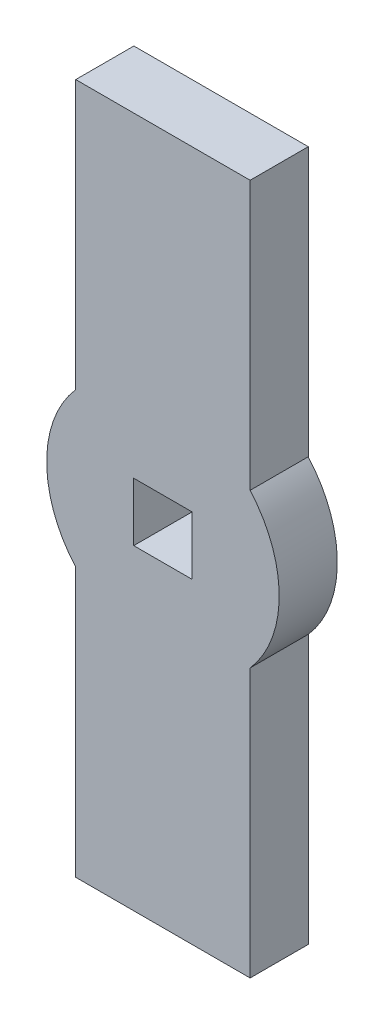
from build123d import *

# Parameters (mm, degrees)
SKETCH2_R           = 2.032
BOSS_EXTRUDE1_DEPTH = 6.35
SKETCH3_W           = 6.38
SKETCH3_H           = 6.38
CUT_EXTRUDE1_DEPTH  = 41.320135459


with BuildPart() as part:
    # Sketch2 → Boss-Extrude1 (new body)
    with BuildSketch(Plane.XY):
        with BuildLine():
            Line((-9.525, 8.400260413), (-9.525, 37.737260413))
            Line((-9.525, 37.737260413), (9.525, 37.737260413))
            Line((9.525, 37.737260413), (9.525, 8.400260413))
            ThreePointArc((9.525, 8.400260413), (12.7, 0), (9.525, -8.400260413))
            Line((9.525, -8.400260413), (9.525, -37.737260413))
            Line((9.525, -37.737260413), (-9.525, -37.737260413))
            Line((-9.525, -37.737260413), (-9.525, -8.400260413))
            ThreePointArc((-9.525, -8.400260413), (-12.7, 0), (-9.525, 8.400260413))
        make_face()
        Circle(SKETCH2_R, mode=Mode.SUBTRACT)
    extrude(amount=BOSS_EXTRUDE1_DEPTH)

    # Sketch3 → Cut-Extrude1 (cut, through all)
    with BuildSketch(Plane(origin=(0, 0, 0), x_dir=(-1, 0, 0), z_dir=(0, 0, -1))):
        Rectangle(SKETCH3_W, SKETCH3_H)
    extrude(amount=-CUT_EXTRUDE1_DEPTH, mode=Mode.SUBTRACT)


solid = part.part
